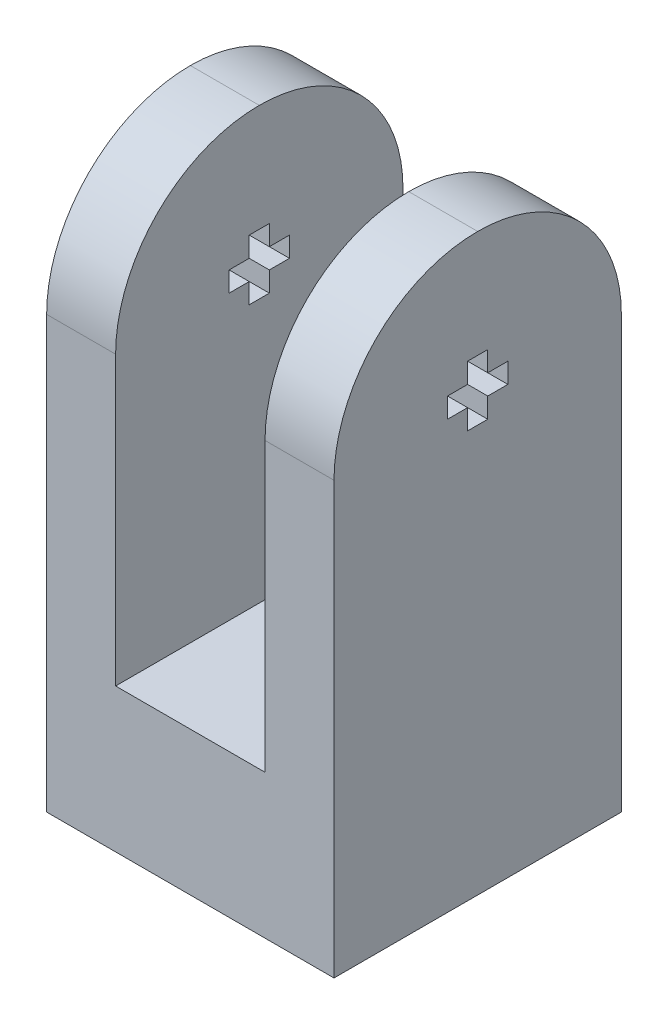
from build123d import *

# Parameters (mm, degrees)
SKETCH1_W           = 25.4
SKETCH1_H           = 25.4
BOSS_EXTRUDE1_DEPTH = 50.8
SKETCH2_W           = 13.208
SKETCH2_H           = 25.4
CUT_EXTRUDE1_DEPTH  = 38.1
CUT_EXTRUDE2_DEPTH  = 59.198711326
FILLET1_R           = 12.7


with BuildPart() as part:
    # Sketch1 → Boss-Extrude1 (new body)
    with BuildSketch(Plane(origin=(0, 0, 0), x_dir=(1, 0, 0), z_dir=(0, 1, 0))):
        Rectangle(SKETCH1_W, SKETCH1_H)
    extrude(amount=BOSS_EXTRUDE1_DEPTH)

    # Sketch2 → Cut-Extrude1 (cut)
    with BuildSketch(Plane(origin=(0, 50.8, 0), x_dir=(1, 0, 0), z_dir=(0, 1, 0))):
        Rectangle(SKETCH2_W, SKETCH2_H)
    extrude(amount=-CUT_EXTRUDE1_DEPTH, mode=Mode.SUBTRACT)

    # Sketch3 → Cut-Extrude2 (cut, through all)
    with BuildSketch(Plane(origin=(12.7, 0, 0), x_dir=(0, 0, -1), z_dir=(1, 0, 0))):
        Polygon((-0.889, 41.312023576), (0.889, 41.312023576), (0.889, 39.534023576), (2.667, 39.534023576), (2.667, 37.756023576), (0.889, 37.756023576), (0.889, 35.978023576), (-0.889, 35.978023576), (-0.889, 37.756023576), (-2.667, 37.756023576), (-2.667, 39.534023576), (-0.889, 39.534023576), align=None)
    extrude(amount=-CUT_EXTRUDE2_DEPTH, mode=Mode.SUBTRACT)

    # Fillet1
    fillet1_edges = [part.edges().sort_by_distance(p)[0] for p in [
        (9.652, 50.8, -12.7),
        (-9.652, 50.8, -12.7),
        (-9.652, 50.8, 12.7),
        (9.652, 50.8, 12.7),
    ]]
    fillet(fillet1_edges, radius=FILLET1_R - 0.0001)  # a hair under: the kernel refuses the full size


solid = part.part
